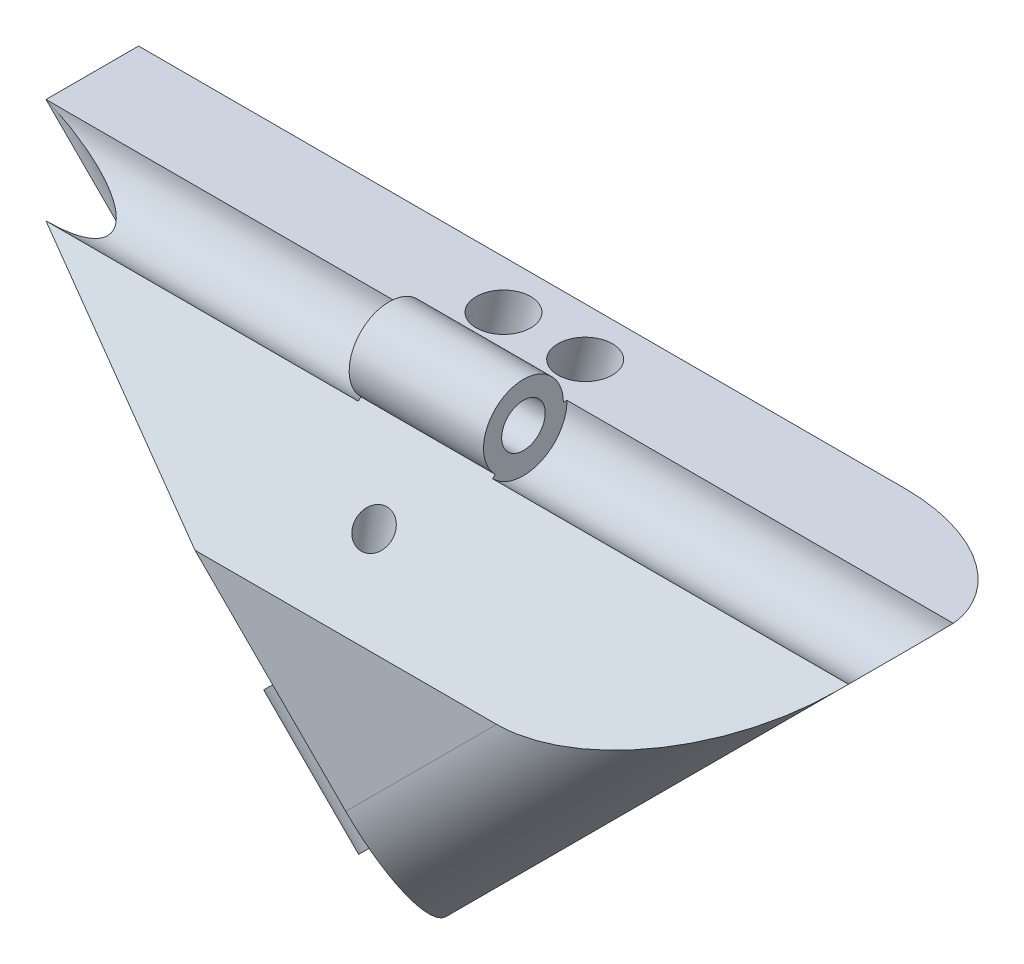
from build123d import *

# Parameters (mm, degrees)
BOSS_EXTRUDE1_DEPTH      = 15
CUT_EXTRUDE1_DEPTH       = 34.582402799
CUT_EXTRUDE1_DEPTH_BACK  = 34.582402799
SKETCH2_R                = 2.4
BOSS_EXTRUDE2_DEPTH      = 3.7
BOSS_EXTRUDE2_DEPTH_BACK = 3.7
SKETCH4_R                = 2.4
SKETCH4_R_2              = 2.2
SKETCH4_R_3              = 1.2
CUT_EXTRUDE2_DEPTH       = 42.134683932
BOSS_EXTRUDE3_START      = -3.8
SKETCH4_3_R              = 1.2
BOSS_EXTRUDE3_DEPTH      = 7.4
FILLET1_R                = 5.5
FILLET2_R                = 5.5


with BuildPart() as part:
    # Sketch1 → Boss-Extrude1 (new body)
    with BuildSketch(Plane(origin=(0, 0, 0), x_dir=(0, 1, 0), z_dir=(0, 0, 1))):
        Polygon((8.333333333, 25), (8.333333333, -25), (-16.666666667, 0), align=None)
    extrude(amount=BOSS_EXTRUDE1_DEPTH)

    # Sketch2 → Cut-Extrude1 (cut, two sides: drawn at the far end of the back side and taken through both)
    with BuildSketch(Plane.YZ.offset(-CUT_EXTRUDE1_DEPTH_BACK)):
        with Locations((8.333333333, 7.5)):
            Circle(SKETCH2_R)
        Polygon((8.333333333, 7.5), (8.333333333, 15), (0.833333333, 15), align=None)
        with BuildLine():
            ThreePointArc((8.333333333, 9.9), (7.414893096, 9.717310878), (6.636277058, 9.197056275))
            Line((6.636277058, 9.197056275), (6.777698415, 9.055634919))
            ThreePointArc((6.777698415, 9.055634919), (7.491429782, 9.532534972), (8.333333333, 9.7))
            Line((8.333333333, 9.7), (8.333333333, 9.9))
        make_face()
        with BuildLine():
            ThreePointArc((8.333333333, 9.7), (7.491429782, 9.532534972), (6.777698415, 9.055634919))
            Line((6.777698415, 9.055634919), (7.484805196, 8.348528137))
            ThreePointArc((7.484805196, 8.348528137), (7.874113214, 8.608655439), (8.333333333, 8.7))
            Line((8.333333333, 8.7), (8.333333333, 9.7))
        make_face()
        with BuildLine():
            Line((7.484805196, 8.348528137), (6.777698415, 9.055634919))
            ThreePointArc((6.777698415, 9.055634919), (6.300798362, 6.658096449), (8.333333333, 5.3))
            ThreePointArc((8.333333333, 5.3), (9.888968252, 5.944365081), (10.533333333, 7.5))
            ThreePointArc((10.533333333, 7.5), (9.888968252, 9.055634919), (8.333333333, 9.7))
            Line((8.333333333, 9.7), (8.333333333, 8.7))
            ThreePointArc((8.333333333, 8.7), (9.181861471, 8.348528137), (9.533333333, 7.5))
            ThreePointArc((9.533333333, 7.5), (7.874113214, 6.391344561), (7.484805196, 8.348528137))
        make_face()
        with BuildLine():
            ThreePointArc((8.333333333, 8.7), (7.874113214, 8.608655439), (7.484805196, 8.348528137))
            Line((7.484805196, 8.348528137), (8.333333333, 7.5))
            Line((8.333333333, 7.5), (8.333333333, 8.7))
        make_face()
        with BuildLine():
            Line((8.333333333, 7.5), (7.484805196, 8.348528137))
            ThreePointArc((7.484805196, 8.348528137), (7.874113214, 6.391344561), (9.533333333, 7.5))
            ThreePointArc((9.533333333, 7.5), (9.181861471, 8.348528137), (8.333333333, 8.7))
            Line((8.333333333, 8.7), (8.333333333, 7.5))
        make_face()
    extrude(amount=CUT_EXTRUDE1_DEPTH + CUT_EXTRUDE1_DEPTH_BACK, mode=Mode.SUBTRACT)

    # Sketch2<5> → Boss-Extrude2 (add, two sides: drawn at the far end of the back side and taken through both)
    with BuildSketch(Plane.YZ.offset(-BOSS_EXTRUDE2_DEPTH_BACK)):
        with BuildLine():
            Line((6.777698415, 9.055634919), (6.636277058, 9.197056275))
            ThreePointArc((6.636277058, 9.197056275), (6.116022455, 6.581559762), (8.333333333, 5.1))
            Line((8.333333333, 5.1), (8.333333333, 5.3))
            ThreePointArc((8.333333333, 5.3), (6.300798362, 6.658096449), (6.777698415, 9.055634919))
        make_face()
        with BuildLine():
            ThreePointArc((8.333333333, 9.7), (7.491429782, 9.532534972), (6.777698415, 9.055634919))
            Line((6.777698415, 9.055634919), (7.484805196, 8.348528137))
            ThreePointArc((7.484805196, 8.348528137), (7.874113214, 8.608655439), (8.333333333, 8.7))
            Line((8.333333333, 8.7), (8.333333333, 9.7))
        make_face()
        with BuildLine():
            Line((7.484805196, 8.348528137), (6.777698415, 9.055634919))
            ThreePointArc((6.777698415, 9.055634919), (6.300798362, 6.658096449), (8.333333333, 5.3))
            ThreePointArc((8.333333333, 5.3), (9.888968252, 5.944365081), (10.533333333, 7.5))
            ThreePointArc((10.533333333, 7.5), (9.888968252, 9.055634919), (8.333333333, 9.7))
            Line((8.333333333, 9.7), (8.333333333, 8.7))
            ThreePointArc((8.333333333, 8.7), (9.181861471, 8.348528137), (9.533333333, 7.5))
            ThreePointArc((9.533333333, 7.5), (7.874113214, 6.391344561), (7.484805196, 8.348528137))
        make_face()
    extrude(amount=BOSS_EXTRUDE2_DEPTH + BOSS_EXTRUDE2_DEPTH_BACK)

    # Sketch4 → Cut-Extrude2 (cut, through all)
    # profile 1 of 3: a face of its own
    with BuildSketch(Plane(origin=(8.333333333, -8.333333333, 0), x_dir=(0.7071067811865486, 0.7071067811865465, 0), z_dir=(0.7071067811865465, -0.7071067811865486, 0))):
        with Locations((-11.78511302, 7.5)):
            Circle(SKETCH4_R)
        with Locations((-11.78511302, 7.5)):
            Circle(SKETCH4_R_2, mode=Mode.SUBTRACT)
    # profile 2 of 3: a face of its own
    with BuildSketch(Plane(origin=(8.333333333, -8.333333333, 0), x_dir=(0.7071067811865486, 0.7071067811865465, 0), z_dir=(0.7071067811865465, -0.7071067811865486, 0))):
        with Locations((-11.78511302, 7.5)):
            Circle(SKETCH4_R_3)
    # profile 3 of 3: a face of its own
    with BuildSketch(Plane(origin=(8.333333333, -8.333333333, 0), x_dir=(0.7071067811865486, 0.7071067811865465, 0), z_dir=(0.7071067811865465, -0.7071067811865486, 0))):
        Polygon((-11.78511302, 7.5), (-4.28511302, 15), (-11.78511302, 15), align=None)
    extrude(amount=-CUT_EXTRUDE2_DEPTH, mode=Mode.SUBTRACT)


with BuildPart() as cut_extrude2_kept_piece:
    # of the separate pieces the step leaves, the one the design keeps (cut_extrude2_pieces_kept)
    add(part.part.solids().sort_by_distance((-25, 8.333333333, 0))[0])

    # Sketch4<3> → Boss-Extrude3 (add)
    with BuildSketch(Plane(origin=(8.333333333, -8.333333333, 0), x_dir=(0.7071067811865486, 0.7071067811865465, 0), z_dir=(0.7071067811865465, -0.7071067811865486, 0)).offset(BOSS_EXTRUDE3_START)):
        with BuildLine():
            Line((-11.78511302, 5.3), (-11.78511302, 5.1))
            ThreePointArc((-11.78511302, 5.1), (-9.567802142, 6.581559762), (-10.088056745, 9.197056275))
            Line((-10.088056745, 9.197056275), (-10.229478101, 9.055634919))
            ThreePointArc((-10.229478101, 9.055634919), (-13.817647991, 8.341903551), (-11.78511302, 5.3))
        make_face()
        with Locations((-11.78511302, 7.5)):
            Circle(SKETCH4_3_R, mode=Mode.SUBTRACT)
    extrude(amount=-BOSS_EXTRUDE3_DEPTH)

    # Fillet1
    fillet1_edges = [cut_extrude2_kept_piece.edges().sort_by_distance(p)[0] for p in [
        (12.5, -4.166666667, 0),
    ]]
    fillet(fillet1_edges, radius=FILLET1_R)

    # Fillet2
    fillet2_edges = [cut_extrude2_kept_piece.edges().sort_by_distance(p)[0] for p in [
        (11.401650429, -5.265016237, 15),
    ]]
    fillet(fillet2_edges, radius=FILLET2_R)

    # Cut-Loft1: read off the stored shape, not the designer's step
    # Cut-Loft1: loft between two sections, ruled curve by curve
    cut_loft1_from = [
        Edge.make_bspline([(-0.780037402, 4.247975845, 11.585357488), (-0.727892994, 4.29393999, 11.539393344), (-0.661002861, 4.341451036, 11.491882298), (-0.486258531, 4.427982909, 11.405350424), (-0.37773802, 4.466988385, 11.366344948), (-0.119442352, 4.513863, 11.319470333), (0.030886977, 4.520936001, 11.312397333), (0.339194689, 4.479887019, 11.353446314), (0.495726658, 4.430828939, 11.402504394), (0.755739125, 4.283342282, 11.549991051), (0.85742023, 4.185934374, 11.647398959), (0.980967134, 3.982022818, 11.851310515), (1.003811506, 3.876720642, 11.956612691), (0.995127807, 3.688258836, 12.145074497), (0.964819046, 3.604889374, 12.22844396), (0.883263184, 3.465498283, 12.367835051), (0.832181809, 3.409020048, 12.424313286), (0.727892994, 3.317091758, 12.516241575), (0.661002861, 3.269580712, 12.563752621), (0.486258531, 3.183048839, 12.650284494), (0.37773802, 3.144043363, 12.68928997), (0.119442352, 3.097168748, 12.736164585), (-0.030886977, 3.090095747, 12.743237586), (-0.339194689, 3.131144729, 12.702188605), (-0.495726658, 3.180202809, 12.653130524), (-0.755739125, 3.327689466, 12.505643867), (-0.85742023, 3.425097374, 12.40823596), (-0.980967134, 3.62900893, 12.204324403), (-1.003811506, 3.734311106, 12.099022227), (-0.995127807, 3.922772912, 11.910560421), (-0.964819046, 4.006142375, 11.827190959), (-0.883263184, 4.145533465, 11.687799868), (-0.832181809, 4.2020117, 11.631321633), (-0.780037402, 4.247975845, 11.585357488)], [0, 0, 0, 0, 0.0625, 0.0625, 0.125, 0.125, 0.1875, 0.1875, 0.25, 0.25, 0.3125, 0.3125, 0.375, 0.375, 0.4375, 0.4375, 0.5, 0.5, 0.5625, 0.5625, 0.625, 0.625, 0.6875, 0.6875, 0.75, 0.75, 0.8125, 0.8125, 0.875, 0.875, 0.9375, 0.9375, 1, 1, 1, 1], 3),
    ]
    cut_loft1_to = [
        Edge.make_bspline([(-2.942962207, -7.687612903, 11.768161272), (-2.960079955, -7.748006682, 11.713352345), (-2.97091826, -7.821128364, 11.653983669), (-2.962732482, -7.997871839, 11.534795379), (-2.943341865, -8.102036376, 11.474851165), (-2.852553416, -8.332500848, 11.376085302), (-2.780090013, -8.458954557, 11.33790839), (-2.577527193, -8.697189205, 11.312684599), (-2.447282041, -8.807423656, 11.326834302), (-2.166844782, -8.965457814, 11.413386364), (-2.018593417, -9.01216386, 11.485189748), (-1.75537809, -9.036408091, 11.65416783), (-1.641064457, -9.015208413, 11.749990212), (-1.462633136, -8.936456733, 11.931846055), (-1.397668226, -8.879828871, 12.017825129), (-1.30534529, -8.759724839, 12.168033678), (-1.2774564, -8.696211634, 12.23266472), (-1.243220903, -8.575424074, 12.342282574), (-1.232382599, -8.502302392, 12.40165125), (-1.240568377, -8.325558918, 12.52083954), (-1.259958994, -8.221394381, 12.580783753), (-1.350747443, -7.990929909, 12.679549617), (-1.423210846, -7.8644762, 12.717726528), (-1.625773666, -7.626241552, 12.74295032), (-1.756018818, -7.516007101, 12.728800617), (-2.036456077, -7.357972942, 12.642248555), (-2.184707442, -7.311266897, 12.570445171), (-2.447922769, -7.287022665, 12.401467089), (-2.562236402, -7.308222344, 12.305644707), (-2.740667723, -7.386974024, 12.123788863), (-2.805632633, -7.443601886, 12.037809789), (-2.897955569, -7.563705918, 11.88760124), (-2.925844458, -7.627219123, 11.822970199), (-2.942962207, -7.687612903, 11.768161272)], [0, 0, 0, 0, 0.0625, 0.0625, 0.125, 0.125, 0.1875, 0.1875, 0.25, 0.25, 0.3125, 0.3125, 0.375, 0.375, 0.4375, 0.4375, 0.5, 0.5, 0.5625, 0.5625, 0.625, 0.625, 0.6875, 0.6875, 0.75, 0.75, 0.8125, 0.8125, 0.875, 0.875, 0.9375, 0.9375, 1, 1, 1, 1], 3),
    ]
    cut_loft1 = Solid(Shell([*[Face.make_surface_from_curves(cut_loft1_from[k], cut_loft1_to[k]) for k in range(1)], Face(Wire(cut_loft1_from)), Face(Wire(cut_loft1_to))]))
    add(cut_loft1, mode=Mode.SUBTRACT)

    # Cut-Loft2: read off the stored shape, not the designer's step
    # Cut-Loft2: loft between two sections, ruled curve by curve
    cut_loft2_from = [
        Edge.make_bspline([(-1.968928028, 8.333333333, 1.176569124), (-1.846142122, 8.333333333, 1.199991788), (-1.710094901, 8.333333333, 1.241418272), (-1.425125623, 8.333333333, 1.38699475), (-1.275764099, 8.333333333, 1.492043002), (-1.006403694, 8.333333333, 1.787753963), (-0.887507445, 8.333333333, 1.979942272), (-0.747782094, 8.333333333, 2.429308619), (-0.729723795, 8.333333333, 2.685500159), (-0.823414453, 8.333333333, 3.176643785), (-0.934515031, 8.333333333, 3.408196952), (-1.229851161, 8.333333333, 3.774570882), (-1.411147334, 8.333333333, 3.909494424), (-1.77045077, 8.333333333, 4.085281344), (-1.947994443, 8.333333333, 4.127969094), (-2.266542452, 8.333333333, 4.158418492), (-2.408286066, 8.333333333, 4.14685354), (-2.653857878, 8.333333333, 4.100008212), (-2.789905099, 8.333333333, 4.058581728), (-3.074874377, 8.333333333, 3.91300525), (-3.224235901, 8.333333333, 3.807956998), (-3.493596306, 8.333333333, 3.512246037), (-3.612492555, 8.333333333, 3.320057728), (-3.752217906, 8.333333333, 2.870691381), (-3.770276205, 8.333333333, 2.614499841), (-3.676585547, 8.333333333, 2.123356215), (-3.565484969, 8.333333333, 1.891803048), (-3.270148839, 8.333333333, 1.525429118), (-3.088852666, 8.333333333, 1.390505576), (-2.72954923, 8.333333333, 1.214718656), (-2.552005557, 8.333333333, 1.172030906), (-2.233457548, 8.333333333, 1.141581508), (-2.091713934, 8.333333333, 1.15314646), (-1.968928028, 8.333333333, 1.176569124)], [0, 0, 0, 0, 0.0625, 0.0625, 0.125, 0.125, 0.1875, 0.1875, 0.25, 0.25, 0.3125, 0.3125, 0.375, 0.375, 0.4375, 0.4375, 0.5, 0.5, 0.5625, 0.5625, 0.625, 0.625, 0.6875, 0.6875, 0.75, 0.75, 0.8125, 0.8125, 0.875, 0.875, 0.9375, 0.9375, 1, 1, 1, 1], 3),
    ]
    cut_loft2_to = [
        Edge.make_bspline([(-7.858496611, -8.808170056, 2.025007577), (-7.821668579, -8.844998088, 1.911374869), (-7.770238094, -8.896428573, 1.789166807), (-7.622134315, -9.044532352, 1.547235947), (-7.524770004, -9.141896663, 1.42730104), (-7.276217363, -9.390449303, 1.236400098), (-7.124167816, -9.542498851, 1.166869281), (-6.792014211, -9.874652456, 1.138562872), (-6.613055651, -10.053611015, 1.182242109), (-6.29165382, -10.375012847, 1.390572917), (-6.151434782, -10.515231885, 1.553782752), (-5.949772196, -10.71689447, 1.928105728), (-5.887761452, -10.778905215, 2.136389187), (-5.827768334, -10.838898333, 2.527287706), (-5.828454974, -10.838211693, 2.709888519), (-5.861368337, -10.80529833, 3.026485141), (-5.893257591, -10.773409076, 3.161359716), (-5.966913654, -10.699753013, 3.388625131), (-6.018344139, -10.648322528, 3.510833193), (-6.166447918, -10.500218749, 3.752764053), (-6.263812229, -10.402854437, 3.87269896), (-6.51236487, -10.154301797, 4.063599902), (-6.664414418, -10.002252249, 4.133130719), (-6.996568022, -9.670098644, 4.161437128), (-7.175526582, -9.491140085, 4.117757891), (-7.496928413, -9.169738254, 3.909427083), (-7.637147451, -9.029519216, 3.746217248), (-7.838810037, -8.82785663, 3.371894272), (-7.900820782, -8.765845885, 3.163610813), (-7.960813899, -8.705852767, 2.772712294), (-7.960127259, -8.706539408, 2.590111481), (-7.927213896, -8.73945277, 2.273514859), (-7.895324643, -8.771342024, 2.138640284), (-7.858496611, -8.808170056, 2.025007577)], [0, 0, 0, 0, 0.0625, 0.0625, 0.125, 0.125, 0.1875, 0.1875, 0.25, 0.25, 0.3125, 0.3125, 0.375, 0.375, 0.4375, 0.4375, 0.5, 0.5, 0.5625, 0.5625, 0.625, 0.625, 0.6875, 0.6875, 0.75, 0.75, 0.8125, 0.8125, 0.875, 0.875, 0.9375, 0.9375, 1, 1, 1, 1], 3),
    ]
    cut_loft2 = Solid(Shell([*[Face.make_surface_from_curves(cut_loft2_from[k], cut_loft2_to[k]) for k in range(1)], Face(Wire(cut_loft2_from)), Face(Wire(cut_loft2_to))]))
    add(cut_loft2, mode=Mode.SUBTRACT)

    # Cut-Loft3: read off the stored shape, not the designer's step
    # Cut-Loft3: loft between two sections, ruled curve by curve
    cut_loft3_from = [
        Edge.make_bspline([(1.725964289, 8.333333333, 1.244515538), (1.843087995, 8.333333333, 1.200845895), (1.980888558, 8.333333333, 1.165689038), (2.300034176, 8.333333333, 1.142320796), (2.482220909, 8.333333333, 1.154649389), (2.865903308, 8.333333333, 1.267732618), (3.067247697, 8.333333333, 1.370363519), (3.419808921, 8.333333333, 1.682058674), (3.568145177, 8.333333333, 1.891716879), (3.742823747, 8.333333333, 2.3602117), (3.767957213, 8.333333333, 2.615806137), (3.705519566, 8.333333333, 3.082233867), (3.620514732, 8.333333333, 3.291630244), (3.40452376, 8.333333333, 3.628302043), (3.274880341, 8.333333333, 3.756896692), (3.018339523, 8.333333333, 3.948173478), (2.891159416, 8.333333333, 4.01181482), (2.656912005, 8.333333333, 4.099154105), (2.519111442, 8.333333333, 4.134310962), (2.199965824, 8.333333333, 4.157679204), (2.017779091, 8.333333333, 4.145350611), (1.634096692, 8.333333333, 4.032267382), (1.432752303, 8.333333333, 3.929636481), (1.080191079, 8.333333333, 3.617941326), (0.931854823, 8.333333333, 3.408283121), (0.757176253, 8.333333333, 2.9397883), (0.732042787, 8.333333333, 2.684193863), (0.794480434, 8.333333333, 2.217766133), (0.879485268, 8.333333333, 2.008369756), (1.09547624, 8.333333333, 1.671697957), (1.225119659, 8.333333333, 1.543103308), (1.481660477, 8.333333333, 1.351826522), (1.608840584, 8.333333333, 1.28818518), (1.725964289, 8.333333333, 1.244515538)], [0, 0, 0, 0, 0.0625, 0.0625, 0.125, 0.125, 0.1875, 0.1875, 0.25, 0.25, 0.3125, 0.3125, 0.375, 0.375, 0.4375, 0.4375, 0.5, 0.5, 0.5625, 0.5625, 0.625, 0.625, 0.6875, 0.6875, 0.75, 0.75, 0.8125, 0.8125, 0.875, 0.875, 0.9375, 0.9375, 1, 1, 1, 1], 3),
    ]
    cut_loft3_to = [
        Edge.make_bspline([(-3.92544087, -12.741225796, 1.180595026), (-3.838855352, -12.827811315, 1.155477383), (-3.738750093, -12.927916573, 1.141954276), (-3.513226542, -13.153440125, 1.167997613), (-3.387278969, -13.279387698, 1.208227176), (-3.131519199, -13.535147468, 1.379030806), (-3.002016946, -13.664649721, 1.511435479), (-2.789621766, -13.8770449, 1.873692104), (-2.708806091, -13.957860575, 2.103687454), (-2.637762668, -14.028903998, 2.593489112), (-2.64802657, -14.018640096, 2.849905789), (-2.742425753, -13.924240913, 3.301160568), (-2.824611611, -13.842055055, 3.494973968), (-3.012169695, -13.654496971, 3.79437993), (-3.116747407, -13.54991926, 3.901482706), (-3.316808995, -13.349857671, 4.050984282), (-3.412594814, -13.254071853, 4.094287331), (-3.585765851, -13.080900816, 4.144522617), (-3.685871109, -12.980795558, 4.158045724), (-3.911394661, -12.755272006, 4.132002387), (-4.037342234, -12.629324433, 4.091772824), (-4.293102004, -12.373564663, 3.920969194), (-4.422604256, -12.24406241, 3.788564521), (-4.634999436, -12.03166723, 3.426307896), (-4.715815111, -11.950851556, 3.196312546), (-4.786858534, -11.879808133, 2.706510888), (-4.776594632, -11.890072034, 2.450094211), (-4.682195449, -11.984471218, 1.998839432), (-4.600009591, -12.066657075, 1.805026032), (-4.412451507, -12.25421516, 1.50562007), (-4.307873796, -12.358792871, 1.398517294), (-4.107812207, -12.55885446, 1.249015718), (-4.012026389, -12.654640278, 1.205712669), (-3.92544087, -12.741225796, 1.180595026)], [0, 0, 0, 0, 0.0625, 0.0625, 0.125, 0.125, 0.1875, 0.1875, 0.25, 0.25, 0.3125, 0.3125, 0.375, 0.375, 0.4375, 0.4375, 0.5, 0.5, 0.5625, 0.5625, 0.625, 0.625, 0.6875, 0.6875, 0.75, 0.75, 0.8125, 0.8125, 0.875, 0.875, 0.9375, 0.9375, 1, 1, 1, 1], 3),
    ]
    cut_loft3 = Solid(Shell([*[Face.make_surface_from_curves(cut_loft3_from[k], cut_loft3_to[k]) for k in range(1)], Face(Wire(cut_loft3_from)), Face(Wire(cut_loft3_to))]))
    add(cut_loft3, mode=Mode.SUBTRACT)


solid = cut_extrude2_kept_piece.part
